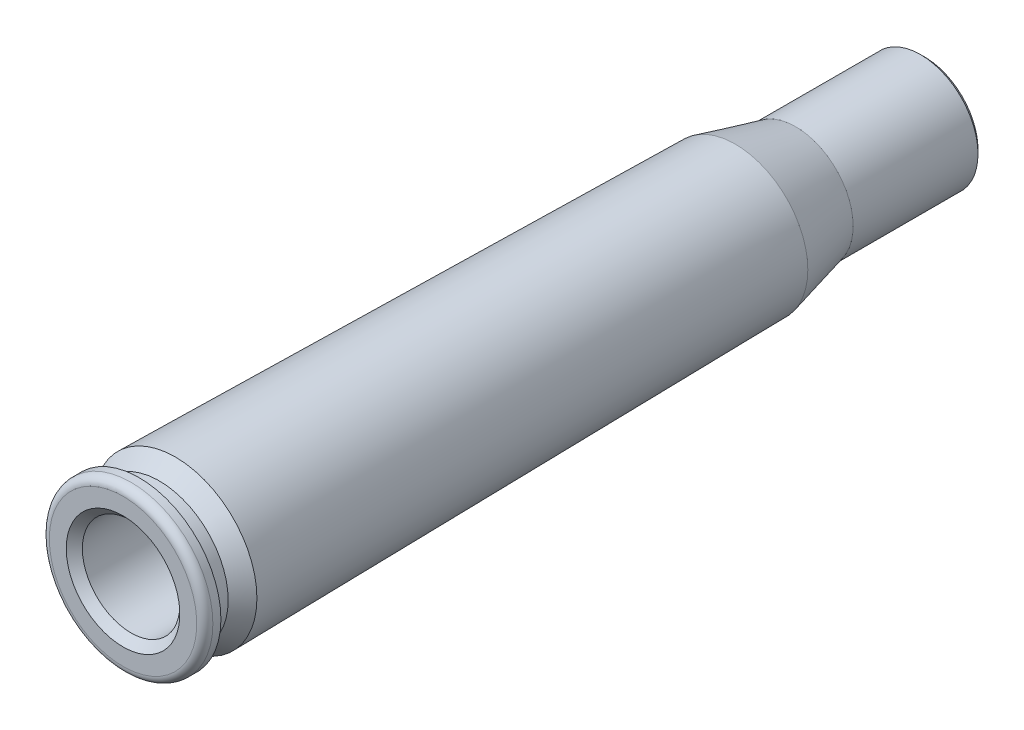
from build123d import *

# Parameters (mm, degrees)
CHAMFER_1_SIZE2 = 1.6
CHAMFER_1_SIZE  = 2
FILLET_1_R      = 1
CHAMFER_2_SIZE  = 0.5
CHAMFER_3_SIZE  = 1


with BuildPart() as part:
    # 스케치2 → 회전1 (revolve)
    with BuildSketch(Plane(origin=(0, 0, 0), x_dir=(0, 0, -1), z_dir=(1, 0, 0)), mode=Mode.PRIVATE) as revolve_1_sk:
        Polygon((76, -9), (83.5, -7.125), (99.5, -7.125), (99.5, -6.05), (83.5, -6.05), (0, -6.05), (0, -10.15), (2, -10.15), (2, -8.55), (4.5, -8.55), (4.5, -10.15), align=None)
    revolve(revolve_1_sk.sketch.rotate(Axis((0, 0, 0), (0, 0, -1)), 270), axis=Axis((0, 0, 0), (0, 0, -1)))

    # 모따기1
    chamfer_1_edges = [part.edges().sort_by_distance(p)[0] for p in [
        (-10.15, 0, -4.5),
    ]]
    chamfer_1_side = [part.faces().sort_by_distance(p)[0] for p in [
        (-10.149485381, 0, -4.531995862),
    ]]
    chamfer(chamfer_1_edges, length=CHAMFER_1_SIZE - 0.0001, length2=CHAMFER_1_SIZE2 - 0.0001, reference=chamfer_1_side[0])  # a hair under: the kernel refuses the full size

    # 필렛1
    fillet_1_edges = [part.edges().sort_by_distance(p)[0] for p in [
        (-10.15, 0, 0),
    ]]
    fillet(fillet_1_edges, radius=FILLET_1_R)

    # 모따기2
    chamfer_2_edges = [part.edges().sort_by_distance(p)[0] for p in [
        (-7.125, 0, -99.5),
    ]]
    chamfer(chamfer_2_edges, length=CHAMFER_2_SIZE)

    # 모따기3
    chamfer_3_edges = [part.edges().sort_by_distance(p)[0] for p in [
        (-6.05, 0, 0),
    ]]
    chamfer(chamfer_3_edges, length=CHAMFER_3_SIZE)


solid = part.part
